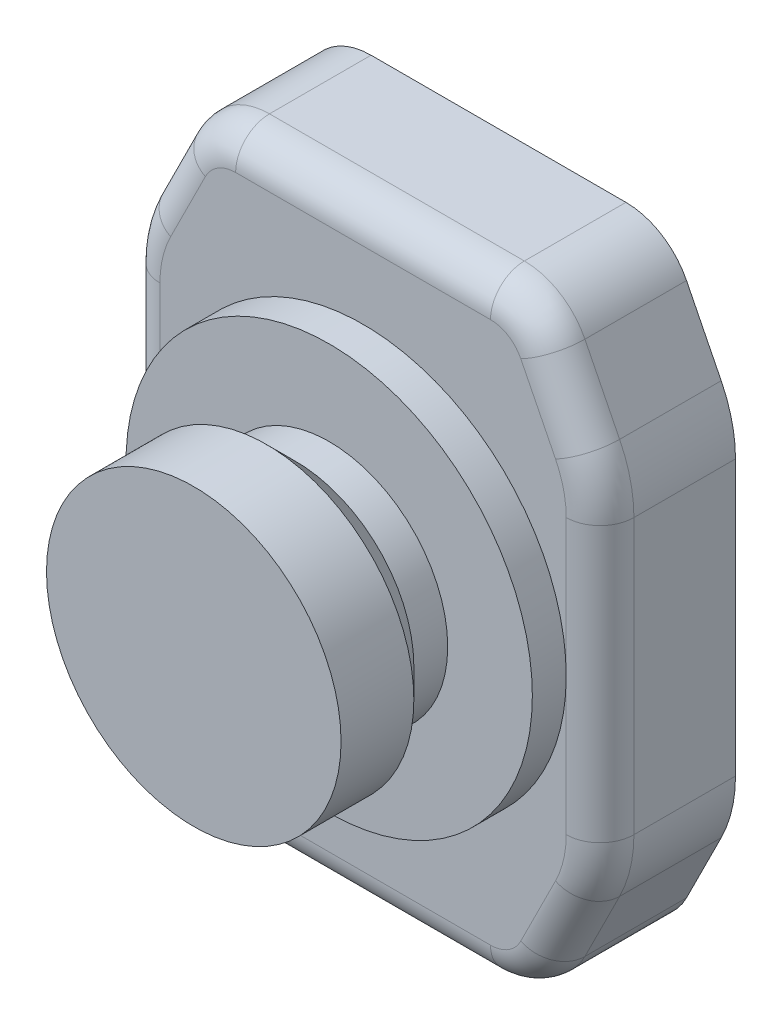
from build123d import *

# Parameters (mm, degrees)
BOSS_EXTRUDE1_DEPTH = 20
FILLET1_R           = 5
SKETCH2_R           = 30
BOSS_EXTRUDE2_DEPTH = 5
SKETCH3_R           = 17.5
BOSS_EXTRUDE3_DEPTH = 10
SKETCH4_R           = 21.75
BOSS_EXTRUDE4_DEPTH = 10
CHAMFER1_SIZE       = 5


with BuildPart() as part:
    # Sketch1 → Boss-Extrude1 (new body)
    with BuildSketch(Plane.XY):
        with BuildLine():
            Line((-32.88854382, 29.22291236), (-27.763932023, 39.472135955))
            ThreePointArc((-27.763932023, 39.472135955), (-24.076971234, 43.506508084), (-18.819660113, 45))
            Line((-18.819660113, 45), (18.819660113, 45))
            ThreePointArc((18.819660113, 45), (24.076971234, 43.506508084), (27.763932023, 39.472135955))
            Line((27.763932023, 39.472135955), (32.88854382, 29.22291236))
            ThreePointArc((32.88854382, 29.22291236), (34.464979789, 24.873698861), (35, 20.27864045))
            Line((35, 20.27864045), (35, -20.27864045))
            ThreePointArc((35, -20.27864045), (34.464979789, -24.873698861), (32.88854382, -29.22291236))
            Line((32.88854382, -29.22291236), (27.763932023, -39.472135955))
            ThreePointArc((27.763932023, -39.472135955), (24.076971234, -43.506508084), (18.819660113, -45))
            Line((18.819660113, -45), (-18.819660113, -45))
            ThreePointArc((-18.819660113, -45), (-24.076971234, -43.506508084), (-27.763932023, -39.472135955))
            Line((-27.763932023, -39.472135955), (-32.88854382, -29.22291236))
            ThreePointArc((-32.88854382, -29.22291236), (-34.464979789, -24.873698861), (-35, -20.27864045))
            Line((-35, -20.27864045), (-35, 20.27864045))
            ThreePointArc((-35, 20.27864045), (-34.464979789, 24.873698861), (-32.88854382, 29.22291236))
        make_face()
    extrude(amount=BOSS_EXTRUDE1_DEPTH)

    # Fillet1
    fillet1_edges = [part.edges().sort_by_distance(p)[0] for p in [
        (24.076971234, -43.506508084, 20),
        (30.326237921, -34.347524158, 20),
        (34.464979789, -24.873698861, 20),
        (35, 0, 20),
        (34.464979789, 24.873698861, 20),
        (30.326237921, 34.347524158, 20),
        (24.076971234, 43.506508084, 20),
        (0, 45, 20),
        (-24.076971234, 43.506508084, 20),
        (-30.326237921, 34.347524158, 20),
        (-24.076971234, -43.506508084, 20),
        (-34.464979789, 24.873698861, 20),
        (-35, 0, 20),
        (-34.464979789, -24.873698861, 20),
        (-30.326237921, -34.347524158, 20),
        (0, -45, 20),
    ]]
    fillet(fillet1_edges, radius=FILLET1_R)

    # Sketch2 → Boss-Extrude2 (add)
    with BuildSketch(Plane.XY.offset(20)):
        Circle(SKETCH2_R)
    extrude(amount=BOSS_EXTRUDE2_DEPTH)

    # Sketch3 → Boss-Extrude3 (add)
    with BuildSketch(Plane.XY.offset(25)):
        Circle(SKETCH3_R)
    extrude(amount=BOSS_EXTRUDE3_DEPTH)

    # Sketch4 → Boss-Extrude4 (add)
    with BuildSketch(Plane.XY.offset(35)):
        Circle(SKETCH4_R)
    extrude(amount=BOSS_EXTRUDE4_DEPTH)

    # Chamfer1
    # the kernel refuses this chamfer: 5 mm, written as the material it adds along each edge
    with BuildSketch(Plane(origin=(0, 0, 35), x_dir=(1, 0, 0), z_dir=(0, -1, 0))) as chamfer1_piece_1_section:
        Polygon((17.5 + CHAMFER1_SIZE, 0), (17.5, -CHAMFER1_SIZE), (17.5, 0), align=None)
    chamfer1_piece_1 = revolve(axis=Axis((0, 0, 35), (0, 0, 1)), mode=Mode.PRIVATE)
    chamfer1_piece_1 = chamfer1_piece_1 & Plane(origin=(0, 0, 32.136850645), x_dir=(1, 0, 0), z_dir=(0, 0, -1)) * Cylinder(21.75, 91, mode=Mode.PRIVATE)
    add(chamfer1_piece_1)


solid = part.part
